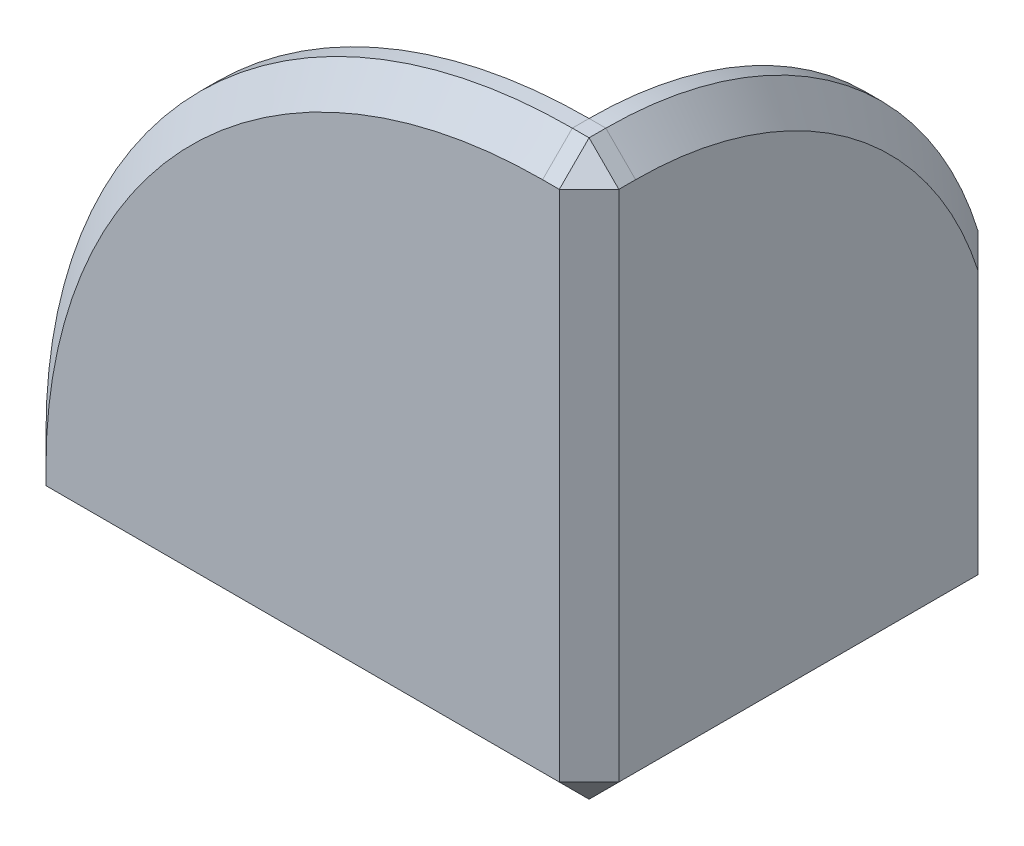
from build123d import *

# Parameters (mm, degrees)
BOSS_EXTRUDE1_DEPTH = 3.175
BOSS_EXTRUDE2_DEPTH = 3.175
BOSS_EXTRUDE3_DEPTH = 3.175


with BuildPart() as part:
    # Sketch1 → Boss-Extrude1 (new body)
    with BuildSketch(Plane.XY):
        with BuildLine():
            Line((0, 0), (0, 35.921024484))
            ThreePointArc((0, 35.921024484), (-25.4, 25.4), (-35.921024484, 0))
            Line((-35.921024484, 0), (0, 0))
        make_face()
    extrude(amount=BOSS_EXTRUDE1_DEPTH)

    # Sketch2 → Boss-Extrude2 (add)
    with BuildSketch(Plane(origin=(0, 0, 0), x_dir=(0, 0, -1), z_dir=(1, 0, 0))):
        with BuildLine():
            Line((0, 0), (25.4, 0))
            Line((25.4, 0), (25.4, 17.145))
            ThreePointArc((25.4, 17.145), (15.793187578, 30.717442473), (0, 35.921024484))
            Line((0, 35.921024484), (-3.175, 35.921024484))
            Line((-3.175, 35.921024484), (-3.175, 0))
            Line((-3.175, 0), (0, 0))
        make_face()
    extrude(amount=BOSS_EXTRUDE2_DEPTH)

    # Sketch3 → Boss-Extrude3 (add)
    with BuildSketch(Plane.XZ):
        with BuildLine():
            Line((0, -25.4), (-17.145, -25.4))
            ThreePointArc((-17.145, -25.4), (-30.717442473, -15.793187578), (-35.921024484, 0))
            Line((-35.921024484, 0), (-35.921024484, 3.175))
            Line((-35.921024484, 3.175), (3.175, 3.175))
            Line((3.175, 3.175), (3.175, -25.4))
            Line((3.175, -25.4), (0, -25.4))
        make_face()
    extrude(amount=BOSS_EXTRUDE3_DEPTH)

    # Chamfer1
    # the kernel refuses this chamfer: 2.032 mm, written as the material it takes off along each edge
    with BuildSketch(Plane(origin=(1.820333333, 34.566357818, 1.820333333), x_dir=(0, -0.7071067811865468, 0.7071067811865481), z_dir=(0.5773502691896253, 0.5773502691896264, 0.5773502691896256))) as chamfer1_piece_1:
        Polygon((-1.436840979, -0.829560526), (1.436840979, -0.829560526), (0, 1.659121052), align=None)
    extrude(amount=2.580986643, mode=Mode.SUBTRACT)
    with BuildSketch(Plane(origin=(1.820333333, -1.820333333, -24.045333333), x_dir=(-0.7071067811865476, 0, -0.7071067811865476), z_dir=(0.5773502691896256, -0.577350269189626, -0.5773502691896256)), Plane(origin=(1.820333333, -1.820333333, 1.820333333), x_dir=(0.7071067811865476, 0, -0.7071067811865474), z_dir=(0.5773502691896254, -0.577350269189626, 0.577350269189626)), Plane(origin=(-34.566357818, -1.820333333, 1.820333333), x_dir=(0.7071067811865468, 0, 0.7071067811865481), z_dir=(-0.5773502691896263, -0.5773502691896255, 0.5773502691896255))) as chamfer1_piece_2:
        Polygon((-1.436840979, 0.829560526), (1.436840979, 0.829560526), (0, -1.659121052), align=None)
    extrude(amount=2.580986643, mode=Mode.SUBTRACT)
    with BuildSketch(Plane(origin=(0, 0, 3.175), x_dir=(0, 1, 0), z_dir=(1, 0, 0))) as chamfer1_piece_3:
        with BuildLine():
            Line((35.978498123, -2.089473639), (33.831550845, 0.057473639))
            Line((33.831550845, 0.057473639), (33.831550845, 0.098113639))
            ThreePointArc((33.831550845, 0.098113639), (34.876287665, 0.04064), (35.921024484, 0.04064))
            Line((35.921024484, 0.04064), (35.961664484, 0))
            ThreePointArc((35.961664484, 0), (35.961664484, -1.04473682), (36.019138123, -2.089473639))
            Line((36.019138123, -2.089473639), (35.978498123, -2.089473639))
        make_face()
    revolve(axis=Axis((0, 0, 3.175), (0, 0, 1)), revolution_arc=90, mode=Mode.SUBTRACT)
    with BuildSketch(Plane(origin=(0, 35.921024484, 3.175), x_dir=(0, -0.9996219169112968, 0.027495876610586455), z_dir=(1, 0, 0)), Plane(origin=(-35.921024484, -3.175, 0), x_dir=(0.9996219169112968, -0.027495876610586455, 0), z_dir=(0, 0, 1))) as chamfer1_piece_4:
        with BuildLine():
            Line((2.090263933, 0), (-0.114903819, 2.087103356))
            Line((-0.114903819, 2.087103356), (-0.155528453, 2.085985924))
            ThreePointArc((-0.155528453, 2.085985924), (-0.069350589, 1.04322439), (-0.040624635, -0.001117432))
            Line((-0.040624635, -0.001117432), (0.001117432, -0.040624635))
            ThreePointArc((0.001117432, -0.040624635), (1.045459255, -0.01189868), (2.091381365, -0.040624635))
            Line((2.091381365, -0.040624635), (2.090263933, 0))
        make_face()
    extrude(amount=8.400659832, mode=Mode.SUBTRACT)
    with BuildSketch(Plane(origin=(3.175, 22.370659832, -25.4), x_dir=(0.027495876610586455, 0, 0.9996219169112968), z_dir=(0, -1, 0))) as chamfer1_piece_5:
        with BuildLine():
            Line((2.090263933, 0), (-0.114903819, 2.087103356))
            Line((-0.114903819, 2.087103356), (-0.155528453, 2.085985924))
            ThreePointArc((-0.155528453, 2.085985924), (-0.069350589, 1.04322439), (-0.040624635, -0.001117432))
            Line((-0.040624635, -0.001117432), (0.001117432, -0.040624635))
            ThreePointArc((0.001117432, -0.040624635), (1.045459255, -0.01189868), (2.091381365, -0.040624635))
            Line((2.091381365, -0.040624635), (2.090263933, 0))
        make_face()
    extrude(amount=30.771319663, mode=Mode.SUBTRACT)
    with BuildSketch(Plane(origin=(3.175, 9.352591527, 0), x_dir=(0, 0.1007624019843993, -0.9949105177584235), z_dir=(0, -0.9949105177584235, -0.1007624019843993))) as chamfer1_piece_6:
        with BuildLine():
            Line((24.478959318, 0.057473639), (26.625906597, -2.089473639))
            Line((26.625906597, -2.089473639), (26.666546597, -2.089473639))
            ThreePointArc((26.666546597, -2.089473639), (26.609072957, -1.04473682), (26.609072957, 0))
            Line((26.609072957, 0), (26.568432957, 0.04064))
            ThreePointArc((26.568432957, 0.04064), (25.523696138, 0.04064), (24.478959318, 0.098113639))
            Line((24.478959318, 0.098113639), (24.478959318, 0.057473639))
        make_face()
    revolve(axis=Axis((3.175, 9.352591527, 0), (1, 0, 0)), revolution_arc=84.216925348, mode=Mode.SUBTRACT)
    with BuildSketch(Plane(origin=(3.175, 35.921024484, 0), x_dir=(0.027495876610586455, -0.9996219169112968, 0), z_dir=(0, 0, 1)), Plane(origin=(-35.921024484, 0, 3.175), x_dir=(0.9996219169112968, 0, 0.027495876610586455), z_dir=(0, -1, 0))) as chamfer1_piece_7:
        with BuildLine():
            Line((2.090263933, 0), (-0.114903819, -2.087103356))
            Line((-0.114903819, -2.087103356), (-0.155528453, -2.085985924))
            ThreePointArc((-0.155528453, -2.085985924), (-0.069350589, -1.04322439), (-0.040624635, 0.001117432))
            Line((-0.040624635, 0.001117432), (0.001117432, 0.040624635))
            ThreePointArc((0.001117432, 0.040624635), (1.045459255, 0.01189868), (2.091381365, 0.040624635))
            Line((2.091381365, 0.040624635), (2.090263933, 0))
        make_face()
    extrude(amount=8.400659832, mode=Mode.SUBTRACT)
    with BuildSketch(Plane(origin=(3.175, -8.400659832, 3.175), x_dir=(-0.9996219169112968, 0, 0.027495876610586435), z_dir=(0, 1, 0)), Plane(origin=(-41.146684316, -3.175, 3.175), x_dir=(0, 0.9996219169112968, 0.027495876610586435), z_dir=(1, 0, 0))) as chamfer1_piece_8:
        with BuildLine():
            Line((2.090263933, 0), (-0.114903819, -2.087103356))
            Line((-0.114903819, -2.087103356), (-0.155528453, -2.085985924))
            ThreePointArc((-0.155528453, -2.085985924), (-0.069350589, -1.04322439), (-0.040624635, 0.001117432))
            Line((-0.040624635, 0.001117432), (0.001117432, 0.040624635))
            ThreePointArc((0.001117432, 0.040624635), (1.045459255, 0.01189868), (2.091381365, 0.040624635))
            Line((2.091381365, 0.040624635), (2.090263933, 0))
        make_face()
    extrude(amount=49.547344147, mode=Mode.SUBTRACT)
    with BuildSketch(Plane(origin=(8.400659832, -3.175, -25.4), x_dir=(0, 0.9996219169112968, -0.027495876610585585), z_dir=(-1, 0, 0))) as chamfer1_piece_9:
        with BuildLine():
            Line((2.090263933, 0), (-0.114903819, -2.087103356))
            Line((-0.114903819, -2.087103356), (-0.155528453, -2.085985924))
            ThreePointArc((-0.155528453, -2.085985924), (-0.069350589, -1.04322439), (-0.040624635, 0.001117432))
            Line((-0.040624635, 0.001117432), (0.001117432, 0.040624635))
            ThreePointArc((0.001117432, 0.040624635), (1.045459255, 0.01189868), (2.091381365, 0.040624635))
            Line((2.091381365, 0.040624635), (2.090263933, 0))
        make_face()
    extrude(amount=30.771319663, mode=Mode.SUBTRACT)
    with BuildSketch(Plane(origin=(3.175, -3.175, 8.400659832), x_dir=(0.027495876610586435, 0.9996219169112968, 0), z_dir=(0, 0, -1))) as chamfer1_piece_10:
        with BuildLine():
            Line((2.090263933, 0), (-0.114903819, -2.087103356))
            Line((-0.114903819, -2.087103356), (-0.155528453, -2.085985924))
            ThreePointArc((-0.155528453, -2.085985924), (-0.069350589, -1.04322439), (-0.040624635, 0.001117432))
            Line((-0.040624635, 0.001117432), (0.001117432, 0.040624635))
            ThreePointArc((0.001117432, 0.040624635), (1.045459255, 0.01189868), (2.091381365, 0.040624635))
            Line((2.091381365, 0.040624635), (2.090263933, 0))
        make_face()
    extrude(amount=39.026319663, mode=Mode.SUBTRACT)
    with BuildSketch(Plane(origin=(-9.352591527, -3.175, 0), x_dir=(-0.1007624019843981, 0, -0.9949105177584237), z_dir=(0.9949105177584237, 0, -0.1007624019843981))) as chamfer1_piece_11:
        with BuildLine():
            Line((26.625906597, 2.089473639), (24.478959318, -0.057473639))
            Line((24.478959318, -0.057473639), (24.478959318, -0.098113639))
            ThreePointArc((24.478959318, -0.098113639), (25.523696138, -0.04064), (26.568432957, -0.04064))
            Line((26.568432957, -0.04064), (26.609072957, 0))
            ThreePointArc((26.609072957, 0), (26.609072957, 1.04473682), (26.666546597, 2.089473639))
            Line((26.666546597, 2.089473639), (26.625906597, 2.089473639))
        make_face()
    revolve(axis=Axis((-9.352591527, -3.175, 0), (0, 1, 0)), revolution_arc=84.216925348, mode=Mode.SUBTRACT)


solid = part.part
